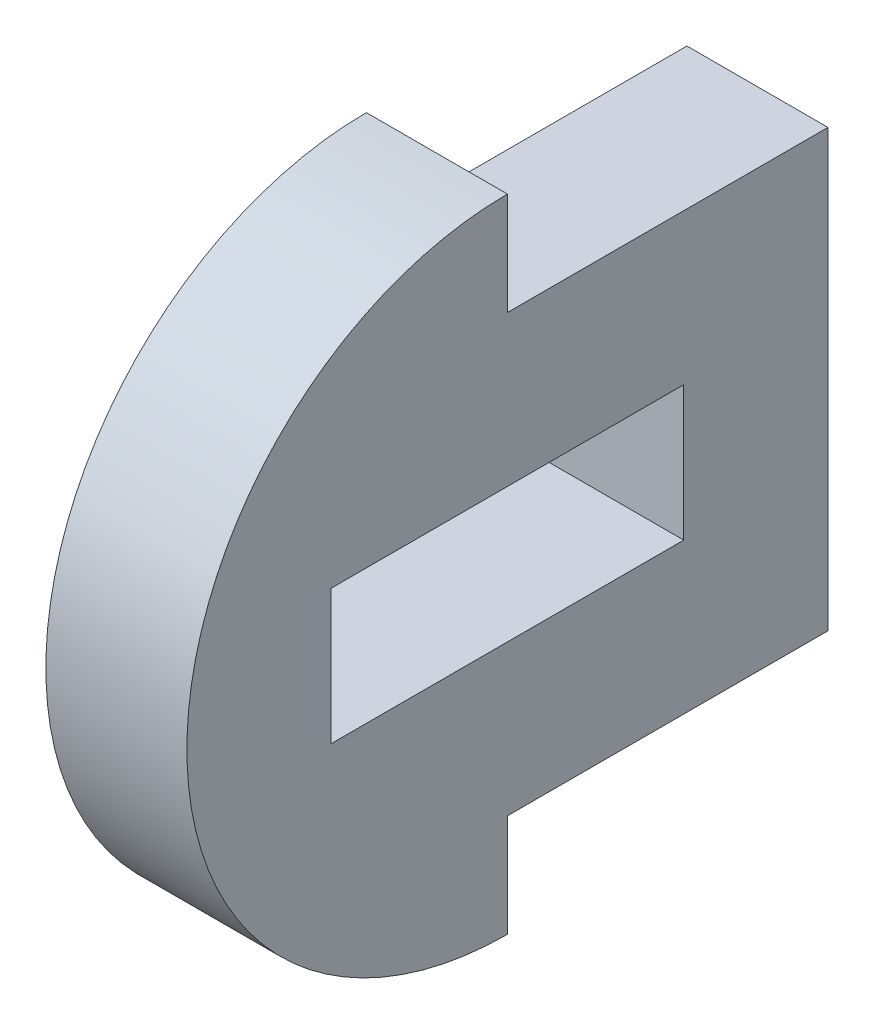
from build123d import *

# Parameters (mm, degrees)
SKETCH1_W           = 11
SKETCH1_H           = 4.2
BOSS_EXTRUDE1_DEPTH = 4.4


with BuildPart() as part:
    # Sketch1 → Boss-Extrude1 (new body)
    with BuildSketch(Plane(origin=(0, 0, 0), x_dir=(0, 0, -1), z_dir=(1, 0, 0))):
        with BuildLine():
            Line((0, 10), (0, 6.8))
            Line((0, 6.8), (10, 6.8))
            Line((10, 6.8), (10, -6.8))
            Line((10, -6.8), (0, -6.8))
            Line((0, -6.8), (0, -10))
            ThreePointArc((0, -10), (-10, 0), (0, 10))
        make_face()
        Rectangle(SKETCH1_W, SKETCH1_H, mode=Mode.SUBTRACT)
    extrude(amount=BOSS_EXTRUDE1_DEPTH)


solid = part.part
